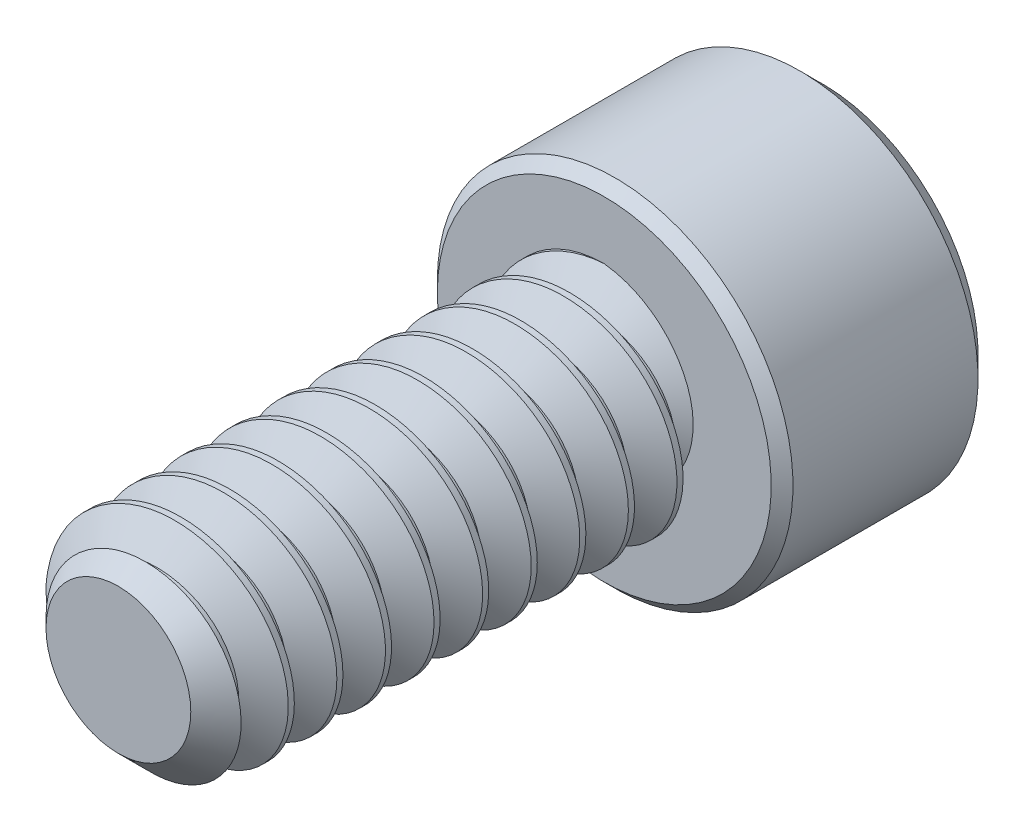
from build123d import *

# Parameters (mm, degrees)
SKETCH1_R          = 1.4224
EXTRUDE1_DEPTH     = 6.35
CHAMFER3_SIZE      = 0.47625
CUT_SWEEP1_PITCH   = 0.635
SKETCH6_R          = 2.3241
EXTRUDE2_DEPTH     = 2.8448
CUT_EXTRUDE1_DEPTH = 1.7859375
SKETCH8_R          = 1.374815329
CUT_EXTRUDE2_DEPTH = 0.28448
CUT_EXTRUDE2_DRAFT = -45
CHAMFER1_SIZE      = 0.28448
CHAMFER2_SIZE      = 0.14224


with BuildPart() as part:
    # Sketch1 → Extrude1 (new body)
    with BuildSketch(Plane.XY):
        Circle(SKETCH1_R)
    extrude(amount=-EXTRUDE1_DEPTH)

    # Chamfer3
    chamfer3_edges = [part.edges().sort_by_distance(p)[0] for p in [
        (-1.4224, 0, 0),
    ]]
    chamfer(chamfer3_edges, length=CHAMFER3_SIZE)

    # Cut-Sweep1: the profile of Sketch3 profile screwed along a right-hand helix of 11 turns, 6 arcs to a turn; built about Z, then put on its axis
    cut_sweep1_z = Axis((0, 0, 0), (0, 0, 1))
    cut_sweep1_corners = [(1.4227, 0, -0.555798205), (1.009955401, 0, -0.3175), (1.009955401, 0, -0.238125), (1.4227, 0, 0.000173205)]
    with BuildLine(mode=Mode.PRIVATE) as cut_sweep1_profile:
        Line(cut_sweep1_corners[0], cut_sweep1_corners[1])
        Line(cut_sweep1_corners[1], cut_sweep1_corners[2])
        Line(cut_sweep1_corners[2], cut_sweep1_corners[3])
        Line(cut_sweep1_corners[3], cut_sweep1_corners[0])
    cut_sweep1_cap = Face(cut_sweep1_profile.wire())
    cut_sweep1_turn_angles = [0, 30, 60, 90, 120, 150, 180, 210, 240, 270, 300, 330, 360]
    cut_sweep1_turn_weights = [1, 0.8660254037844387, 1, 0.8660254037844387, 1, 0.8660254037844387, 1, 0.8660254037844387, 1, 0.8660254037844387, 1, 0.8660254037844387, 1]
    cut_sweep1_turn_rails = [Edge.make_bspline([Vector(p[0], p[1], 0).rotate(cut_sweep1_z, cut_sweep1_turn_angles[k]) / cut_sweep1_turn_weights[k] + Vector(0, 0, p[2] + CUT_SWEEP1_PITCH * cut_sweep1_turn_angles[k] / 360) for k in range(13)], [0, 0, 0, 1, 1, 2, 2, 3, 3, 4, 4, 5, 5, 6, 6, 6], 2, cut_sweep1_turn_weights) for p in cut_sweep1_corners]
    cut_sweep1_turn_sides = [Face.make_surface_from_curves(cut_sweep1_turn_rails[p[0]], cut_sweep1_turn_rails[p[1]]) for p in [(0, 1), (1, 2), (2, 3), (3, 0)]]
    cut_sweep1 = Plane(origin=(0, 0, 0), x_dir=(0, 1, 0), z_dir=(0, 0, -1)) * Solid(Shell([*[p.moved(Location((0, 0, CUT_SWEEP1_PITCH * i))) for i in range(11) for p in cut_sweep1_turn_sides], cut_sweep1_cap, cut_sweep1_cap.rotate(cut_sweep1_z, 3960).moved(Location((0, 0, CUT_SWEEP1_PITCH * 3960 / 360)))]))
    add(cut_sweep1, mode=Mode.SUBTRACT)

    # Sketch6 → Extrude2 (add)
    with BuildSketch(Plane(origin=(0, 0, -6.35), x_dir=(-1, 0, 0), z_dir=(0, 0, -1))):
        Circle(SKETCH6_R)
    extrude(amount=EXTRUDE2_DEPTH)

    # Sketch7 → Cut-Extrude1 (cut)
    with BuildSketch(Plane(origin=(0, 0, -9.1948), x_dir=(-1, 0, 0), z_dir=(0, 0, -1))):
        Polygon((0, 1.374815329), (-1.190625, 0.687407664), (-1.190625, -0.687407664), (0, -1.374815329), (1.190625, -0.687407664), (1.190625, 0.687407664), align=None)
    extrude(amount=-CUT_EXTRUDE1_DEPTH, mode=Mode.SUBTRACT)


with BuildPart() as cut_extrude2_tool:
    # Sketch8 → Cut-Extrude2 (with draft: the straight prism first)
    with BuildSketch(Plane(origin=(0, 0, -9.1948), x_dir=(-1, 0, 0), z_dir=(0, 0, -1))):
        Circle(SKETCH8_R)
    extrude(amount=-CUT_EXTRUDE2_DEPTH)
    # Cut-Extrude2: the draft: its side faces are tilted about the plane it starts from
    cut_extrude2_sides = [cut_extrude2_tool.faces().sort_by_distance(p)[0] for p in [
        (1.374815329, 0, -9.05256),
    ]]
    draft(cut_extrude2_sides, Plane(origin=(0, 0, -9.1948), x_dir=(-1, 0, 0), z_dir=(0, 0, -1)), CUT_EXTRUDE2_DRAFT)


with BuildPart() as part_1:
    add(part.part)

    # Cut-Extrude2: cut by cut_extrude2_tool
    add(cut_extrude2_tool.part, mode=Mode.SUBTRACT)

    # Chamfer1
    chamfer1_edges = [part_1.edges().sort_by_distance(p)[0] for p in [
        (2.3241, 0, -9.1948),
    ]]
    chamfer(chamfer1_edges, length=CHAMFER1_SIZE)

    # Chamfer2
    chamfer2_edges = [part_1.edges().sort_by_distance(p)[0] for p in [
        (2.3241, 0, -6.35),
    ]]
    chamfer(chamfer2_edges, length=CHAMFER2_SIZE)


solid = part_1.part
